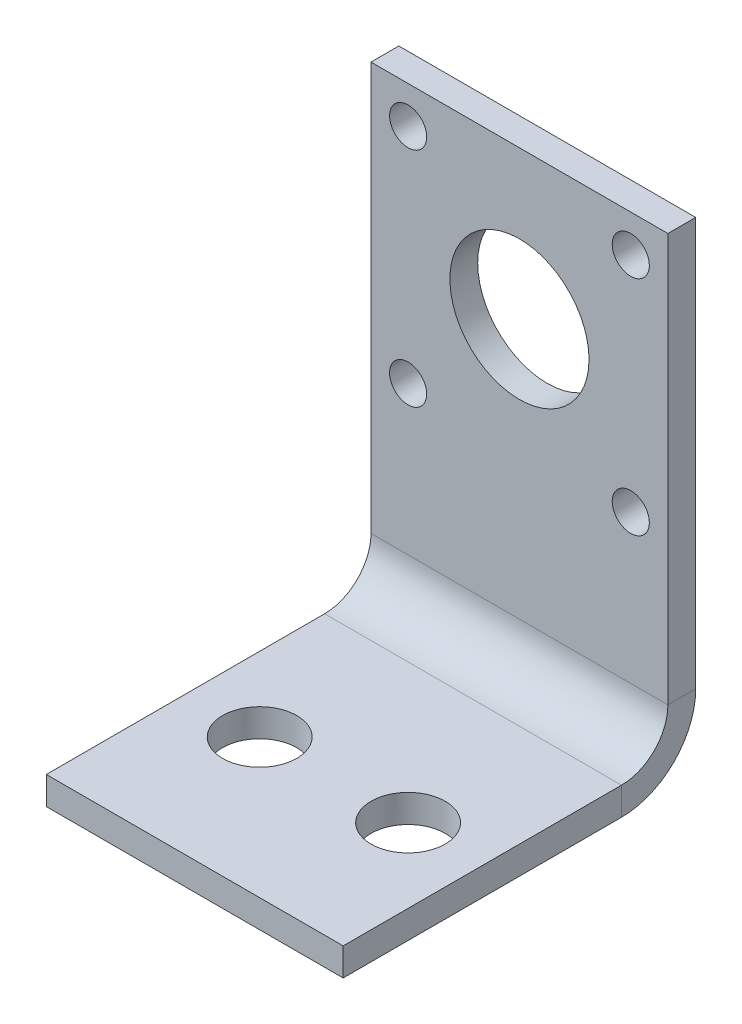
from build123d import *

# Parameters (mm, degrees)
SKETCH5_W          = 32
SKETCH5_H          = 30
BASE_FLANGE1_DEPTH = 3
EDGE_FLANGE1_DEPTH = 32
SKETCH13_R         = 4
CUT_EXTRUDE1_DEPTH = 10
SKETCH14_R         = 7.5
SKETCH14_R_2       = 2
CUT_EXTRUDE2_DEPTH = 10


# Sheet-metal steps are written as plain solids
with BuildPart() as part:
    # Sketch5 → Base-Flange1 (new body)
    with BuildSketch(Plane(origin=(0, 0, 0), x_dir=(1, 0, 0), z_dir=(0, 1, 0))):
        Rectangle(SKETCH5_W, SKETCH5_H)
    extrude(amount=BASE_FLANGE1_DEPTH)

    # Edge-Flange1 section (across the edge) → Edge-Flange1 (add)
    with BuildSketch(Plane(origin=(16, 3, -20), x_dir=(0, 0, 1), z_dir=(-1, 0, 0))):
        with BuildLine():
            Line((-3, 5), (-3, 49))
            Line((-3, 49), (0, 49))
            Line((0, 49), (0, 5))
            ThreePointArc((0, 5), (1.464466094, 1.464466094), (5, 0))
            Line((5, 0), (5, -3))
            ThreePointArc((5, -3), (-0.656854249, -0.656854249), (-3, 5))
        make_face()
    extrude(amount=EDGE_FLANGE1_DEPTH)

    # Sketch13 → Cut-Extrude1 (cut)
    with BuildSketch(Plane(origin=(0, 3, 0), x_dir=(1, 0, 0), z_dir=(0, 1, 0))):
        with Locations(Location((-8, 0, 0), (0, 0, 270))):
            Circle(SKETCH13_R)
        with Locations(Location((8, 0, 0), (0, 0, 270))):
            Circle(SKETCH13_R)
    extrude(amount=-CUT_EXTRUDE1_DEPTH, mode=Mode.SUBTRACT)

    # Sketch14 → Cut-Extrude2 (cut)
    with BuildSketch(Plane.XY.offset(-20)):
        with Locations((0, 36)):
            Circle(SKETCH14_R)
        with Locations((-12, 48)):
            Circle(SKETCH14_R_2)
        with Locations(Location((12, 48, 0), (0, 0, 270))):
            Circle(SKETCH14_R_2)
        with Locations((12, 24)):
            Circle(SKETCH14_R_2)
        with Locations(Location((-12, 24, 0), (0, 0, 270))):
            Circle(SKETCH14_R_2)
    extrude(amount=-CUT_EXTRUDE2_DEPTH, mode=Mode.SUBTRACT)


solid = part.part
